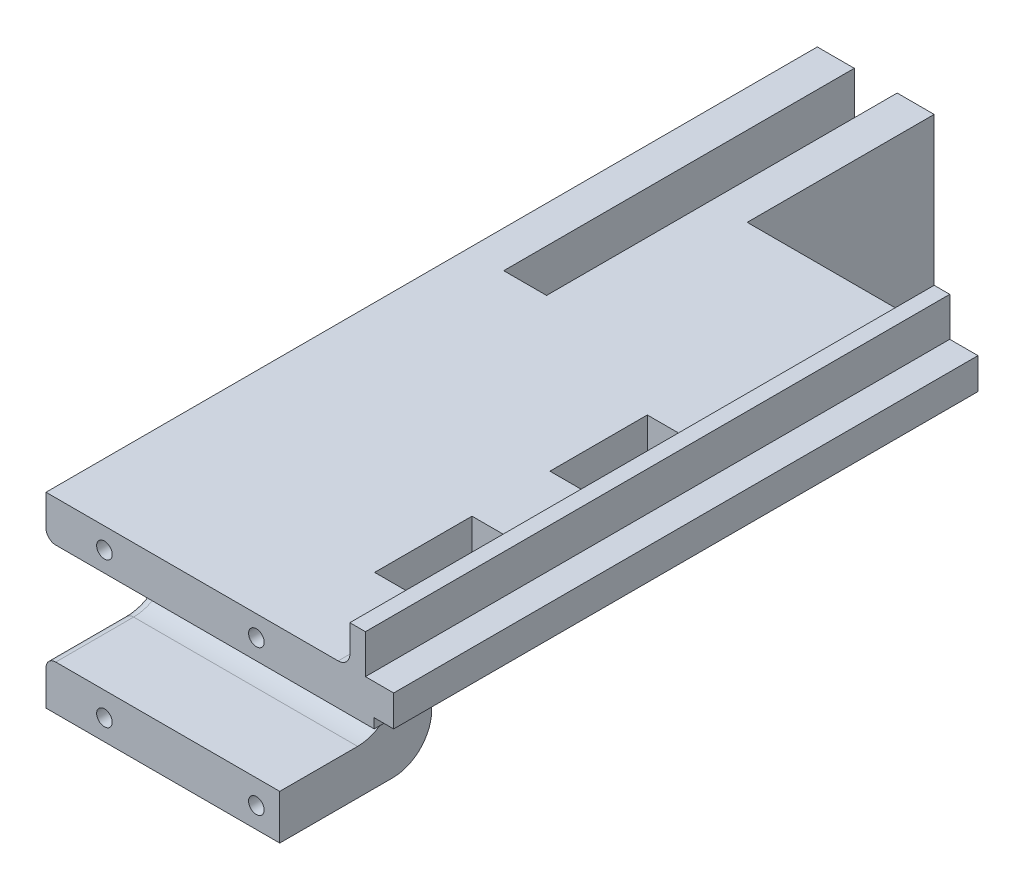
from build123d import *

# Parameters (mm, degrees)
CROQUIS1_W                 = 60
CROQUIS1_H                 = 48
SALIENTE_EXTRUIR1_DEPTH    = 6
CROQUIS4_W                 = 60
CROQUIS4_H                 = 11.5
SALIENTE_EXTRUIR3_DEPTH    = 30
CROQUIS5_R                 = 2
CORTAR_EXTRUIR3_DEPTH      = 16
CROQUIS6_W                 = 30
CROQUIS6_H                 = 48
SALIENTE_EXTRUIR4_DEPTH    = 162
CROQUIS7_R                 = 2
CORTAR_EXTRUIR4_DEPTH      = 16
CROQUIS11_W                = 150
CROQUIS11_H                = 11.5
SALIENTE_EXTRUIR6_DEPTH    = 59.25
CROQUIS12_W                = 4
CROQUIS12_H                = 150
SALIENTE_EXTRUIR7_DEPTH    = 10
CORTAR_EXTRUIR6_DEPTH      = 170.016303475
CORTAR_EXTRUIR6_DEPTH_BACK = 170.016303475
CROQUIS14_W                = 5
CROQUIS14_H                = 3.5
CORTAR_EXTRUIR7_DEPTH      = 213.768679181
CORTAR_EXTRUIR7_DEPTH_BACK = 90
CROQUIS15_W                = 11
CROQUIS15_H                = 11
CROQUIS16_W                = 30
CROQUIS16_H                = 1
CORTAR_EXTRUIR10_DEPTH     = 190.450484429
REDONDEO1_R                = 10
CROQUIS20_W                = 30
CROQUIS20_H                = 36.5
SALIENTE_EXTRUIR8_DEPTH    = 50
CROQUIS21_W                = 9
CROQUIS21_H                = 25
CORTAR_EXTRUIR11_DEPTH     = 40
CROQUIS22_W                = 30
CROQUIS22_H                = 36.5
CORTAR_EXTRUIR13_DEPTH     = 47
REDONDEO3_R                = 10
CROQUIS23_R                = 2
CORTAR_EXTRUIR14_DEPTH     = 16
REDONDEO4_R                = 3
CORTAR_EXTRUIR15_DEPTH     = 170
REDONDEO5_R                = 6
REDONDEO6_R                = 2.5


with BuildPart() as part:
    # Croquis1 → Saliente-Extruir1 (new body)
    with BuildSketch(Plane.XY):
        with Locations((-36.216216216, 7.011261261)):
            Rectangle(CROQUIS1_W, CROQUIS1_H)
    extrude(amount=SALIENTE_EXTRUIR1_DEPTH)

    # Croquis4 → Saliente-Extruir3 (add)
    with BuildSketch(Plane.XY.offset(6)):
        with Locations((-36.216216216, 25.261261261)):
            Rectangle(CROQUIS4_W, CROQUIS4_H)
        with Locations((-36.216216216, -11.238738739)):
            Rectangle(CROQUIS4_W, CROQUIS4_H)
    extrude(amount=SALIENTE_EXTRUIR3_DEPTH)

    # Croquis5 → Cortar-Extruir3 (cut)
    with BuildSketch(Plane.XY.offset(36)):
        with Locations((-51.216216216, 25.661261261)):
            Circle(CROQUIS5_R)
        with Locations((-12.216216216, 25.661261261)):
            Circle(CROQUIS5_R)
        with Locations((-12.216216216, -11.638738739)):
            Circle(CROQUIS5_R)
        with Locations((-51.216216216, -11.638738739)):
            Circle(CROQUIS5_R)
    extrude(amount=-CORTAR_EXTRUIR3_DEPTH, mode=Mode.SUBTRACT)

    # Croquis6 → Saliente-Extruir4 (add)
    with BuildSketch(Plane(origin=(0, 0, 0), x_dir=(-1, 0, 0), z_dir=(0, 0, -1))):
        with Locations((51.216216216, 7.011261261)):
            Rectangle(CROQUIS6_W, CROQUIS6_H)
    extrude(amount=SALIENTE_EXTRUIR4_DEPTH)

    # Croquis7 → Cortar-Extruir4 (cut)
    with BuildSketch(Plane(origin=(0, 0, -162), x_dir=(-1, 0, 0), z_dir=(0, 0, -1))):
        with Locations((51.216216216, 7.011261261)):
            Circle(CROQUIS7_R)
    extrude(amount=-CORTAR_EXTRUIR4_DEPTH, mode=Mode.SUBTRACT)

    # Croquis11 → Saliente-Extruir6 (add)
    with BuildSketch(Plane(origin=(-36.216216216, 0, 0), x_dir=(0, 0, -1), z_dir=(1, 0, 0))):
        with Locations((39, 25.261261261)):
            Rectangle(CROQUIS11_W, CROQUIS11_H)
    extrude(amount=SALIENTE_EXTRUIR6_DEPTH)

    # Croquis12 → Saliente-Extruir7 (add)
    with BuildSketch(Plane(origin=(0, 31.011261261, 0), x_dir=(1, 0, 0), z_dir=(0, 1, 0))):
        with Locations((13.783783784, 39)):
            Rectangle(CROQUIS12_W, CROQUIS12_H)
    extrude(amount=SALIENTE_EXTRUIR7_DEPTH)

    # Croquis14 → Cortar-Extruir6 (cut, two sides: drawn at the far end of the back side and taken through both)
    with BuildSketch(Plane(origin=(0, 0, -114), x_dir=(-1, 0, 0), z_dir=(0, 0, -1)).offset(-CORTAR_EXTRUIR6_DEPTH_BACK)):
        with Locations((-20.533783784, 21.261261261)):
            Rectangle(CROQUIS14_W, CROQUIS14_H)
    extrude(amount=CORTAR_EXTRUIR6_DEPTH + CORTAR_EXTRUIR6_DEPTH_BACK, mode=Mode.SUBTRACT)

    # Croquis15 → Cortar-Extruir7 (cut, two sides: drawn at the far end of the back side and taken through both)
    with BuildSketch(Plane(origin=(0, 0, -162), x_dir=(-1, 0, 0), z_dir=(0, 0, -1)).offset(-CORTAR_EXTRUIR7_DEPTH_BACK)):
        with Locations((51.216216216, 25.511261261)):
            Rectangle(CROQUIS15_W, CROQUIS15_H)
    extrude(amount=CORTAR_EXTRUIR7_DEPTH + CORTAR_EXTRUIR7_DEPTH_BACK, mode=Mode.SUBTRACT)

    # Croquis16 → Cortar-Extruir10 (cut, through all)
    with BuildSketch(Plane.ZY.offset(66.216216216)):
        with Locations((21, 20.011261261)):
            Rectangle(CROQUIS16_W, CROQUIS16_H)
    extrude(amount=-CORTAR_EXTRUIR10_DEPTH, mode=Mode.SUBTRACT)

    # Redondeo1
    redondeo1_edges = [part.edges().sort_by_distance(p)[0] for p in [
        (-36.216216216, -5.488738739, 6),
        (-24.091216216, 20.511261261, 6),
    ]]
    fillet(redondeo1_edges, radius=REDONDEO1_R)

    # Croquis20 → Saliente-Extruir8 (add)
    with BuildSketch(Plane(origin=(0, 0, 0), x_dir=(-1, 0, 0), z_dir=(0, 0, -1))):
        with Locations((21.216216216, 1.261261261)):
            Rectangle(CROQUIS20_W, CROQUIS20_H)
    extrude(amount=SALIENTE_EXTRUIR8_DEPTH)

    # Croquis21 → Cortar-Extruir11 (cut)
    with BuildSketch(Plane.XZ.offset(-19.511261261)):
        with Locations((-1.716216216, -0.858898944)):
            Rectangle(CROQUIS21_W, CROQUIS21_H)
        with Locations((-1.716216216, -45.858898944)):
            Rectangle(CROQUIS21_W, CROQUIS21_H)
    extrude(amount=-CORTAR_EXTRUIR11_DEPTH, mode=Mode.SUBTRACT)

    # Croquis22 → Cortar-Extruir13 (cut)
    with BuildSketch(Plane(origin=(0, 0, -50), x_dir=(-1, 0, 0), z_dir=(0, 0, -1))):
        with Locations((21.216216216, 1.261261261)):
            Rectangle(CROQUIS22_W, CROQUIS22_H)
    extrude(amount=-CORTAR_EXTRUIR13_DEPTH, mode=Mode.SUBTRACT)

    # Redondeo3
    redondeo3_edges = [part.edges().sort_by_distance(p)[0] for p in [
        (-21.216216216, -16.988738739, -3),
    ]]
    fillet(redondeo3_edges, radius=REDONDEO3_R)

    # Croquis23 → Cortar-Extruir14 (cut)
    with BuildSketch(Plane.XY.offset(36)):
        with Locations((-12.216216216, -11.638738739)):
            Circle(CROQUIS23_R)
        with Locations((-51.216216216, -11.638738739)):
            Circle(CROQUIS23_R)
        with Locations((-12.216216216, 25.661261261)):
            Circle(CROQUIS23_R)
        with Locations((-51.216216216, 25.661261261)):
            Circle(CROQUIS23_R)
    extrude(amount=-CORTAR_EXTRUIR14_DEPTH, mode=Mode.SUBTRACT)

    # Redondeo4
    redondeo4_edges = [part.edges().sort_by_distance(p)[0] for p in [
        (11.783783784, 31.011261261, -39),
    ]]
    fillet(redondeo4_edges, radius=REDONDEO4_R)

    # Croquis24 → Cortar-Extruir15 (cut)
    with BuildSketch(Plane(origin=(0, 0, -162), x_dir=(-1, 0, 0), z_dir=(0, 0, -1))):
        Polygon((48.716216216, -16.988738739), (48.716216216, -12.988738739), (44.216216216, -12.988738739), (44.216216216, -8.988738739), (58.216216216, -8.988738739), (58.216216216, -12.988738739), (53.716216216, -12.988738739), (53.716216216, -16.988738739), align=None)
    extrude(amount=-CORTAR_EXTRUIR15_DEPTH, mode=Mode.SUBTRACT)

    # Redondeo5
    redondeo5_edges = [part.edges().sort_by_distance(p)[0] for p in [
        (-36.216216216, 19.511261261, -58.5),
    ]]
    fillet(redondeo5_edges, radius=REDONDEO5_R)

    # Redondeo6
    redondeo6_edges = [part.edges().sort_by_distance(p)[0] for p in [
        (-66.216216216, 20.511261261, 26),
        (-66.216216216, 17.582329073, 8.928932188),
        (-66.216216216, 7.511261261, 6),
        (-66.216216216, -2.559806551, 8.928932188),
        (-66.216216216, -5.488738739, 26),
    ]]
    fillet(redondeo6_edges, radius=REDONDEO6_R)


solid = part.part
